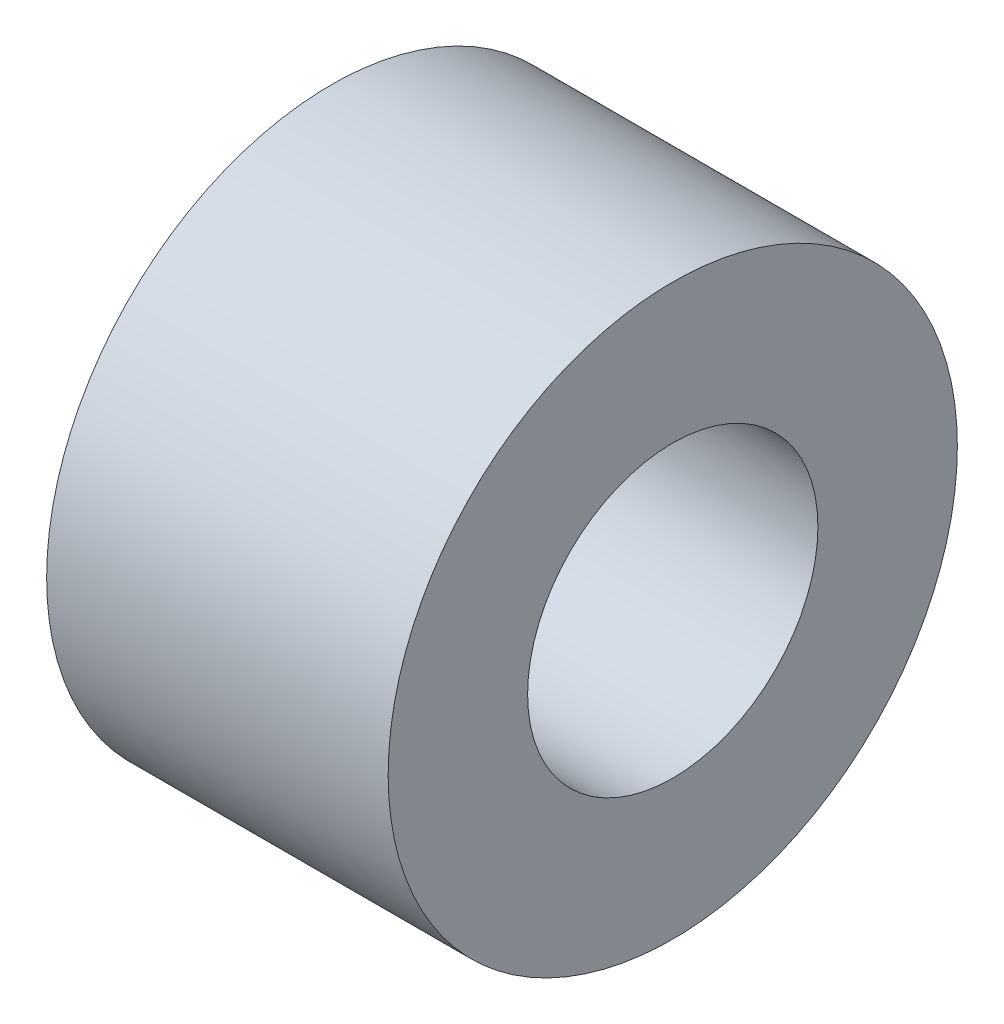
from build123d import *

# Parameters (mm, degrees)
SKETCH1_R           = 6.35
SKETCH1_R_2         = 3.2385
BOSS_EXTRUDE1_DEPTH = 7.62


with BuildPart() as part:
    # Sketch1 → Boss-Extrude1 (new body)
    with BuildSketch(Plane(origin=(0, 0, 0), x_dir=(0, 0, -1), z_dir=(1, 0, 0))):
        Circle(SKETCH1_R)
        Circle(SKETCH1_R_2, mode=Mode.SUBTRACT)
    extrude(amount=BOSS_EXTRUDE1_DEPTH)


solid = part.part
